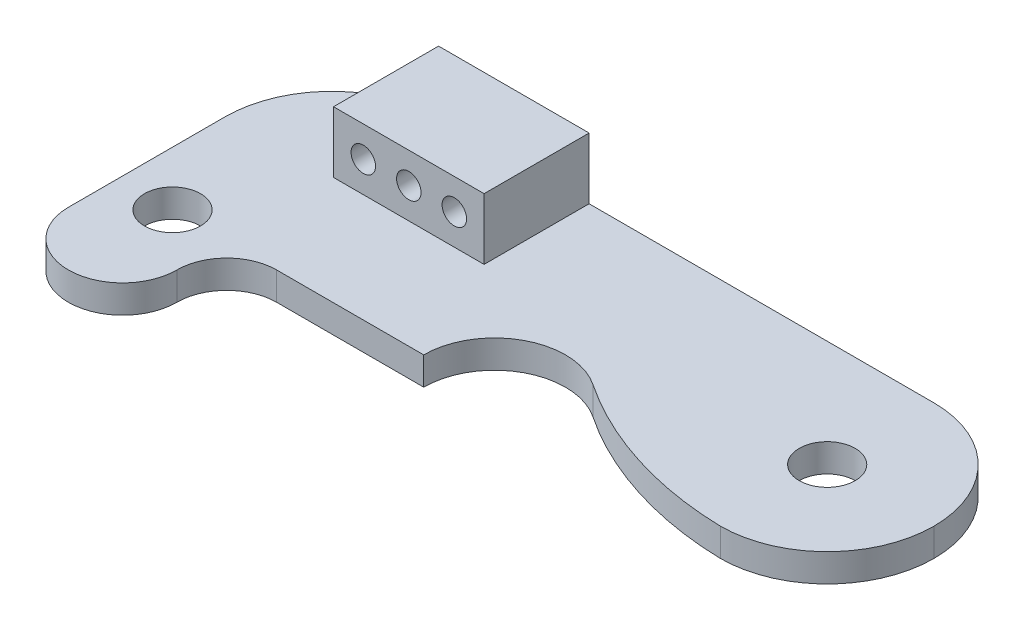
from build123d import *

# Parameters (mm, degrees)
BOSS_EXTRUDE1_DEPTH = 1.6
SKETCH4_R           = 1.6
CUT_EXTRUDE2_DEPTH  = 209.114814948
FILLET2_R           = 6.1
SKETCH2_W           = 8.6
SKETCH2_H           = 6
BOSS_EXTRUDE2_DEPTH = 3.5
CUT_EXTRUDE1_REACH  = 77.737
SKETCH3_R           = 0.7
FILLET1_R           = 20


# Some blends are built 0.0001 mm under size
with BuildPart() as part:
    # Sketch1 → Boss-Extrude1 (new body)
    with BuildSketch(Plane(origin=(0, 0, 0), x_dir=(1, 0, 0), z_dir=(0, 1, 0))):
        with BuildLine():
            Line((32.853134702, -176.602493772), (73.353134702, -176.602493772))
            Line((73.353134702, -176.602493772), (73.353134702, -188.802493772))
            Line((73.353134702, -188.802493772), (41.903134702, -188.802493772))
            ThreePointArc((41.903134702, -188.802493772), (39.887880375, -189.637239445), (39.053134702, -191.652493772))
            ThreePointArc((39.053134702, -191.652493772), (35.953134702, -194.752493772), (32.853134702, -191.652493772))
            Line((32.853134702, -191.652493772), (32.853134702, -176.602493772))
        make_face()
    extrude(amount=BOSS_EXTRUDE1_DEPTH)

    # Sketch4 → Cut-Extrude2 (cut, through all)
    with BuildSketch(Plane(origin=(0, 1.6, 0), x_dir=(1, 0, 0), z_dir=(0, 1, 0))):
        with Locations(Location((67.253134702, -182.702493772, 0), (0, 0, 270))):
            Circle(SKETCH4_R)
        with Locations(Location((35.953134702, -188.802493772, 0), (0, 0, 270))):
            Circle(SKETCH4_R)
        with BuildLine():
            Line((50.303134702, -188.802493772), (58.403134702, -188.802493772))
            ThreePointArc((58.403134702, -188.802493772), (54.353134702, -184.752493772), (50.303134702, -188.802493772))
        make_face()
    extrude(amount=-CUT_EXTRUDE2_DEPTH, mode=Mode.SUBTRACT)

    # Fillet2
    fillet2_edges = [part.edges().sort_by_distance(p)[0] for p in [
        (73.353134702, 0.8, 176.602493772),
        (73.353134702, 0.8, 188.802493772),
        (32.853134702, 0.8, 176.602493772),
    ]]
    fillet(fillet2_edges, radius=FILLET2_R - 0.0001)  # a hair under: the kernel refuses the full size

    # Sketch2 → Boss-Extrude2 (add)
    with BuildSketch(Plane(origin=(0, 1.6, 0), x_dir=(1, 0, 0), z_dir=(0, 1, 0))):
        with Locations((43.253134702, -179.602493772)):
            Rectangle(SKETCH2_W, SKETCH2_H)
    extrude(amount=BOSS_EXTRUDE2_DEPTH)

    # Sketch3 → Cut-Extrude1 (cut, up to next)
    with BuildSketch(Plane(origin=(0, 0, 176.602493772), x_dir=(-1, 0, 0), z_dir=(0, 0, -1)), mode=Mode.PRIVATE) as cut_extrude1_sk1:
        with Locations((-45.853134702, 3.35)):
            Circle(SKETCH3_R)
    cut_extrude1_tool1 = extrude(cut_extrude1_sk1.sketch, amount=-CUT_EXTRUDE1_REACH, mode=Mode.PRIVATE) & part.part
    # Sketch3 → Cut-Extrude1 (cut, up to next)
    with BuildSketch(Plane(origin=(0, 0, 176.602493772), x_dir=(-1, 0, 0), z_dir=(0, 0, -1)), mode=Mode.PRIVATE) as cut_extrude1_sk2:
        with Locations((-40.653134702, 3.35)):
            Circle(SKETCH3_R)
    cut_extrude1_tool2 = extrude(cut_extrude1_sk2.sketch, amount=-CUT_EXTRUDE1_REACH, mode=Mode.PRIVATE) & part.part
    # Sketch3 → Cut-Extrude1 (cut, up to next)
    with BuildSketch(Plane(origin=(0, 0, 176.602493772), x_dir=(-1, 0, 0), z_dir=(0, 0, -1)), mode=Mode.PRIVATE) as cut_extrude1_sk3:
        with Locations((-43.253134702, 3.35)):
            Circle(SKETCH3_R)
    cut_extrude1_tool3 = extrude(cut_extrude1_sk3.sketch, amount=-CUT_EXTRUDE1_REACH, mode=Mode.PRIVATE) & part.part
    add(cut_extrude1_tool1.solids().sort_by_distance((45.853135, 3.35, 176.602494))[0], mode=Mode.SUBTRACT)
    add(cut_extrude1_tool2.solids().sort_by_distance((40.653135, 3.35, 176.602494))[0], mode=Mode.SUBTRACT)
    add(cut_extrude1_tool3.solids().sort_by_distance((43.253135, 3.35, 176.602494))[0], mode=Mode.SUBTRACT)

    # Fillet1
    # the kernel refuses this fillet: 20 mm, written as the material it takes off along each edge
    with BuildSketch(Plane(origin=(58.403134702, 23.72525, 188.802493772), x_dir=(-0.4713226848050216, 0, -0.8819608419811995), z_dir=(0, -1, 0))) as fillet1_piece_1:
        with BuildLine():
            CenterArc((13.244167443, 17.63921684), FILLET1_R, 209.451639401, 32.428171428)
            Line((-4.171252893, 7.805441648), (-4.5195613, 7.608766144))
            ThreePointArc((-4.5195613, 7.608766144), (-2.438410783, 3.71419175), (-0.352784337, -0.188529074))
            Line((-0.352784337, -0.188529074), (0.188529074, -0.352784337))
            ThreePointArc((0.188529074, -0.352784337), (1.908856873, 0.07805859), (3.629184673, -0.352784337))
            Line((3.629184673, -0.352784337), (3.817713747, 0))
        make_face()
    extrude(amount=45.8505, mode=Mode.SUBTRACT)


solid = part.part
